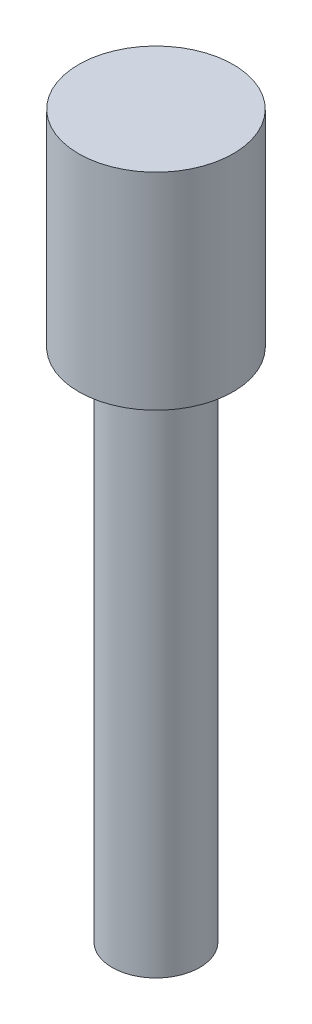
from build123d import *

# Parameters (mm, degrees)
SKETCH1_R           = 10.795
BOSS_EXTRUDE1_DEPTH = 127
SKETCH2_R           = 19.05
BOSS_EXTRUDE2_DEPTH = 50.8


with BuildPart() as part:
    # Sketch1 → Boss-Extrude1 (new body)
    with BuildSketch(Plane(origin=(0, 0, 0), x_dir=(1, 0, 0), z_dir=(0, 1, 0))):
        Circle(SKETCH1_R)
    extrude(amount=BOSS_EXTRUDE1_DEPTH)

    # Sketch2 → Boss-Extrude2 (add)
    with BuildSketch(Plane(origin=(0, 127, 0), x_dir=(1, 0, 0), z_dir=(0, 1, 0))):
        Circle(SKETCH2_R)
    extrude(amount=BOSS_EXTRUDE2_DEPTH)


solid = part.part
